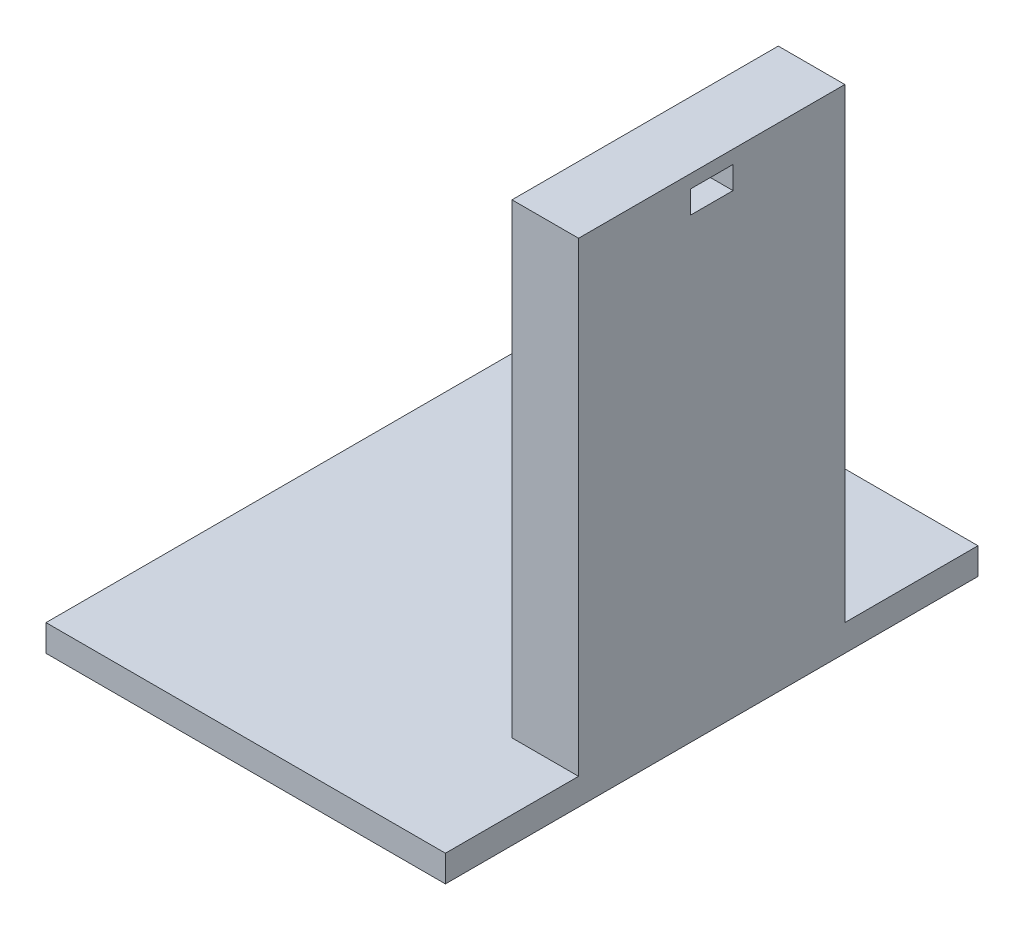
from build123d import *

# Parameters (mm, degrees)
ESQUISSE2_W             = 150
ESQUISSE2_H             = 200
BOSS_EXTRU_6_DEPTH      = 10
ESQUISSE4_W             = 25
ESQUISSE4_H             = 100
BOSS_EXTRU_7_DEPTH      = 180
ESQUISSE8_W             = 24.4
ESQUISSE8_H             = 20.028297961
ENL_V_MAT_EXTRU_1_DEPTH = 12.2
ESQUISSE9_W             = 12
ESQUISSE9_H             = 5
ENL_V_MAT_EXTRU_2_DEPTH = 42.2
ESQUISSE11_W            = 16
ESQUISSE11_H            = 8.51414898
ENL_V_MAT_EXTRU_3_DEPTH = 42.2
ENL_V_MAT_EXTRU_6_DEPTH = 12.2
ESQUISSE13_W            = 25
ESQUISSE13_H            = 100
BOSS_EXTRU_8_DEPTH      = 5
ESQUISSE14_W            = 25.4
ESQUISSE14_H            = 0.5
ENL_V_MAT_EXTRU_7_DEPTH = 12.2


with BuildPart() as part:
    # Esquisse2 → Boss.-Extru.6 (new body)
    with BuildSketch(Plane(origin=(0, 0, 0), x_dir=(1, 0, 0), z_dir=(0, 1, 0))):
        with Locations((-20.308131119, 81.7)):
            Rectangle(ESQUISSE2_W, ESQUISSE2_H)
    extrude(amount=BOSS_EXTRU_6_DEPTH)

    # Esquisse4 → Boss.-Extru.7 (add)
    with BuildSketch(Plane(origin=(0, 0, 0), x_dir=(1, 0, 0), z_dir=(0, 1, 0))):
        with Locations((42.191868881, 81.7)):
            Rectangle(ESQUISSE4_W, ESQUISSE4_H)
    extrude(amount=BOSS_EXTRU_7_DEPTH)

    # Esquisse8 → Enlèv. mat.-Extru.1 (cut)
    with BuildSketch(Plane.ZY.offset(-29.691868881)):
        with Locations((-81.7, 169.985851019)):
            Rectangle(ESQUISSE8_W, ESQUISSE8_H)
    extrude(amount=-ENL_V_MAT_EXTRU_1_DEPTH, mode=Mode.SUBTRACT)

    # Esquisse9 → Enlèv. mat.-Extru.2 (cut)
    with BuildSketch(Plane.ZY.offset(-41.891868881)):
        with Locations((-81.7, 175.98585102)):
            Rectangle(ESQUISSE9_W, ESQUISSE9_H)
    extrude(amount=-ENL_V_MAT_EXTRU_2_DEPTH, mode=Mode.SUBTRACT)

    # Esquisse11 → Enlèv. mat.-Extru.3 (cut)
    with BuildSketch(Plane.ZY.offset(-41.891868881)):
        with Locations((-81.7, 175.74292551)):
            Rectangle(ESQUISSE11_W, ESQUISSE11_H)
    extrude(amount=-ENL_V_MAT_EXTRU_3_DEPTH, mode=Mode.SUBTRACT)

    # Esquisse12 → Enlèv. mat.-Extru.6 (cut)
    with BuildSketch(Plane.ZY.offset(-29.691868881)):
        Polygon((-94.4, 180), (-94.4, 159.97), (-93.9, 159.971702039), (-93.9, 180), align=None)
        Polygon((-69, 159.97), (-69, 180), (-69.5, 180), (-69.5, 159.971702039), align=None)
    extrude(amount=-ENL_V_MAT_EXTRU_6_DEPTH, mode=Mode.SUBTRACT)

    # Esquisse13 → Boss.-Extru.8 (add)
    with BuildSketch(Plane(origin=(0, 180, 0), x_dir=(1, 0, 0), z_dir=(0, 1, 0))):
        with Locations((42.191868881, 81.7)):
            Rectangle(ESQUISSE13_W, ESQUISSE13_H)
    extrude(amount=BOSS_EXTRU_8_DEPTH)

    # Esquisse14 → Enlèv. mat.-Extru.7 (cut)
    with BuildSketch(Plane.ZY.offset(-29.691868881)):
        with Locations((-81.7, 180.25)):
            Rectangle(ESQUISSE14_W, ESQUISSE14_H)
    extrude(amount=-ENL_V_MAT_EXTRU_7_DEPTH, mode=Mode.SUBTRACT)


solid = part.part
